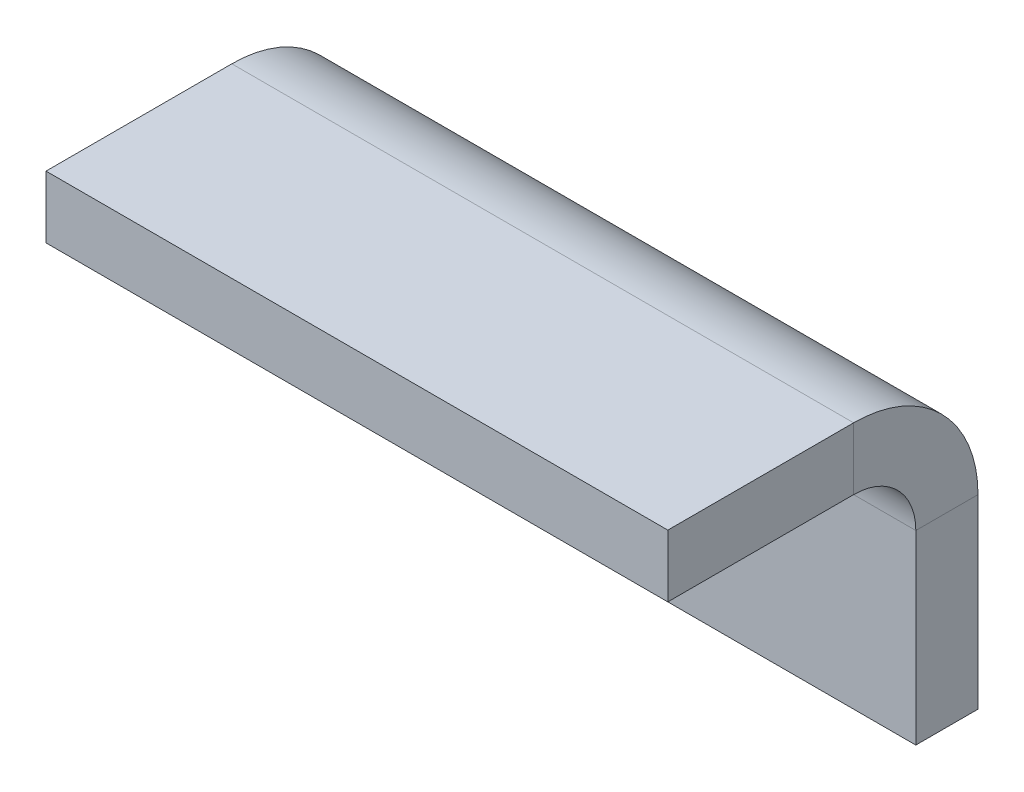
from build123d import *

# Parameters (mm, degrees)
SKETCH1_W              = 30
SKETCH1_H              = 25
BASE_FLANGE1_DEPTH     = 3
SKETCHED_START         = -15
SKETCHED_BEND1_DEPTH   = 30
SKETCHED_BEND1_2_DEPTH = 30


# Read off the part's stored shape, not the designer's step: Sketched Bend1
# Sheet-metal steps are written as plain solids
with BuildPart() as part:
    # Sketch1 → Base-Flange1 (new body)
    with BuildSketch(Plane.XY):
        Rectangle(SKETCH1_W, SKETCH1_H)
    extrude(amount=-BASE_FLANGE1_DEPTH)

    # Sketched Bend1 outline → Sketched Bend1 (cut)
    with BuildSketch(Plane.YZ.offset(SKETCHED_START)):
        with BuildLine():
            Line((12.5, 0), (1.661860688, 0))
            ThreePointArc((1.661860688, 0), (-0.534291735, -2.196152423), (-3.534291735, -3))
            Line((-3.534291735, -3), (12.5, -3))
            Line((12.5, -3), (12.5, 0))
        make_face()
    extrude(amount=SKETCHED_BEND1_DEPTH, mode=Mode.SUBTRACT)

    # Sketched Bend1 2 outline → Sketched Bend1 2 (add)
    with BuildSketch(Plane.YZ.offset(SKETCHED_START)):
        with BuildLine():
            Line((2.465708265, 3), (2.465708265, 11.965708265))
            Line((2.465708265, 11.965708265), (-0.534291735, 11.965708265))
            Line((-0.534291735, 11.965708265), (-0.534291735, 3))
            ThreePointArc((-0.534291735, 3), (-1.412971392, 0.878679657), (-3.534291735, 0))
            Line((-3.534291735, 0), (1.661860688, 0))
            ThreePointArc((1.661860688, 0), (2.261263223, 1.447085729), (2.465708265, 3))
        make_face()
    extrude(amount=SKETCHED_BEND1_2_DEPTH)


solid = part.part
